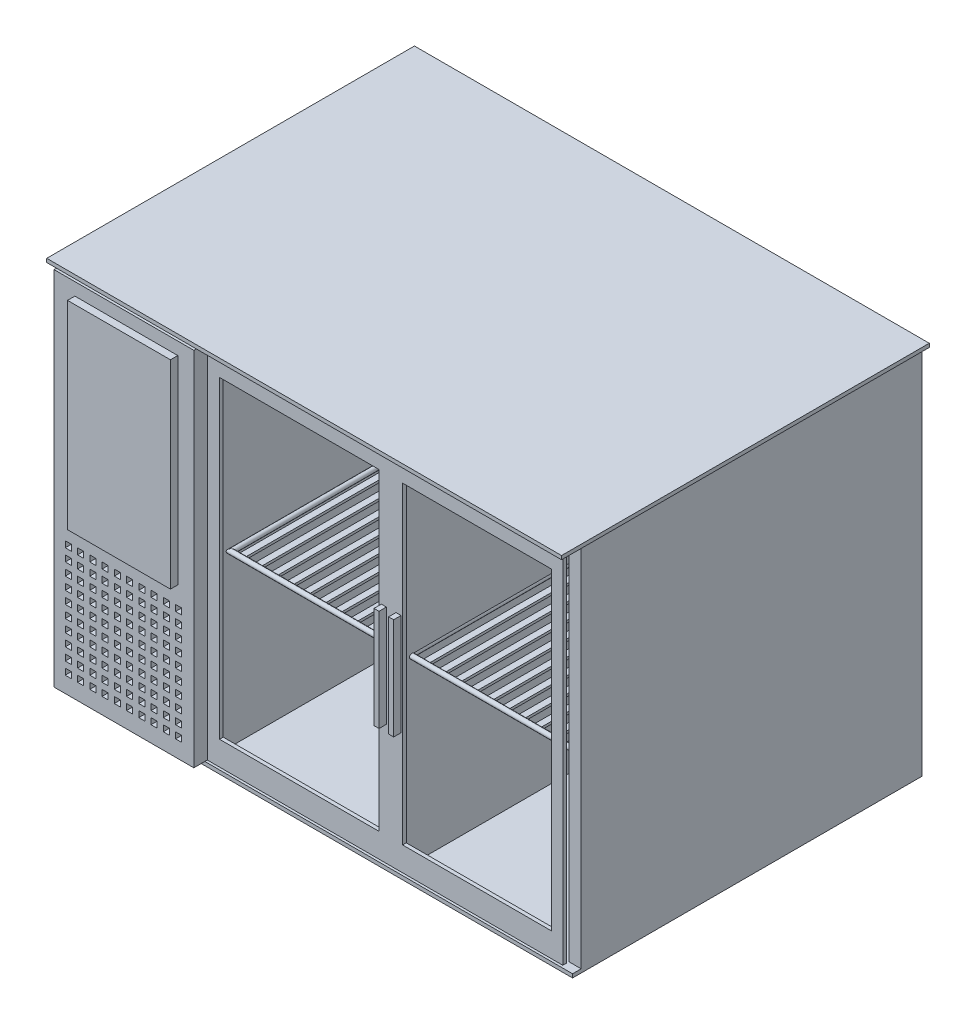
from build123d import *

# Parameters (mm, degrees)
SKETCH_1_W               = 420
SKETCH_1_H               = 300
EXTRUDE_1_DEPTH          = 3
SKETCH_2_W               = 414
SKETCH_2_H               = 294
EXTRUDE_2_DEPTH          = 300
SKETCH_4_W               = 414
SKETCH_4_H               = 285
EXTRUDE_3_DEPTH          = 3
SKETCH_5_W               = 414
SKETCH_5_H               = 5
CUT_EXTRUDE_2_DEPTH      = 16
SKETCH_7_W               = 290
SKETCH_7_H               = 295
CUT_EXTRUDE_4_DEPTH      = 292.885340732
SKETCH_8_W               = 300
SKETCH_8_H               = 295
CUT_EXTRUDE_8_DEPTH      = 16
EXTRUDE_START            = -14
EXTRUDE_6_DEPTH          = 3
EXTRUDE_START_2          = -155
SKETCH_10_W              = 278
SKETCH_10_H              = 303
EXTRUDE_7_DEPTH          = 12
SWEEP_1_PROFILE_R        = 2
SWEEP_1_PROFILE_R_2      = 1
SKETCH_92_W              = 5.167733577
SKETCH_92_H              = 269.760075432
EXTRUDE_17_DEPTH         = 2
PATTERN_LINEAR_1_COUNT   = 10
PATTERN_LINEAR_1_PITCH   = 13
MIRROR_1_COPY_1_SKETCH_W = 5.167733577
MIRROR_1_COPY_1_SKETCH_H = 269.760075432
MIRROR_1_COPY_1_DEPTH    = 2
MIRROR_1_COPY_2_SKETCH_W = 5.167733577
MIRROR_1_COPY_2_SKETCH_H = 269.760075432
MIRROR_1_COPY_2_DEPTH    = 2
MIRROR_1_COPY_3_SKETCH_W = 5.167733577
MIRROR_1_COPY_3_SKETCH_H = 269.760075432
MIRROR_1_COPY_3_DEPTH    = 2
MIRROR_1_COPY_4_SKETCH_W = 5.167733577
MIRROR_1_COPY_4_SKETCH_H = 269.760075432
MIRROR_1_COPY_4_DEPTH    = 2
MIRROR_1_COPY_5_SKETCH_W = 5.167733577
MIRROR_1_COPY_5_SKETCH_H = 269.760075432
MIRROR_1_COPY_5_DEPTH    = 2
MIRROR_1_COPY_6_SKETCH_W = 5.167733577
MIRROR_1_COPY_6_SKETCH_H = 269.760075432
MIRROR_1_COPY_6_DEPTH    = 2
MIRROR_1_COPY_7_SKETCH_W = 5.167733577
MIRROR_1_COPY_7_SKETCH_H = 269.760075432
MIRROR_1_COPY_7_DEPTH    = 2
MIRROR_1_COPY_8_SKETCH_W = 5.167733577
MIRROR_1_COPY_8_SKETCH_H = 269.760075432
MIRROR_1_COPY_8_DEPTH    = 2
MIRROR_1_COPY_9_SKETCH_W = 5.167733577
MIRROR_1_COPY_9_SKETCH_H = 269.760075432
MIRROR_1_COPY_9_DEPTH    = 2
SKETCH_97_W              = 4.098699483
SKETCH_97_H              = 82.865011284
EXTRUDE_18_DEPTH         = 6
SKETCH_98_W              = 5
SKETCH_98_H              = 5
CUT_EXTRUDE_11_DEPTH     = 6
SKETCH_99_W              = 5
SKETCH_99_H              = 5
CUT_EXTRUDE_12_DEPTH     = 6
SKETCH_100_W             = 83.959202725
SKETCH_100_H             = 162.034176658
EXTRUDE_19_DEPTH         = 6


with BuildPart() as part:
    # 草图1 → 凸台-拉伸1 (new body)
    with BuildSketch(Plane(origin=(0, 0, 0), x_dir=(1, 0, 0), z_dir=(0, 1, 0))):
        Rectangle(SKETCH_1_W, SKETCH_1_H)
    extrude(amount=EXTRUDE_1_DEPTH)

    # 草图2 → 凸台-拉伸2 (add)
    with BuildSketch(Plane.XZ):
        Rectangle(SKETCH_2_W, SKETCH_2_H)
    extrude(amount=EXTRUDE_2_DEPTH)

    # 草图4 → 凸台-拉伸3 (add)
    with BuildSketch(Plane.XZ.offset(300)):
        with Locations((0, -4.5)):
            Rectangle(SKETCH_4_W, SKETCH_4_H)
    extrude(amount=EXTRUDE_3_DEPTH)

    # 草图5 → 切除-拉伸2 (cut)
    with BuildSketch(Plane.XY.offset(147)):
        with Locations((0, -2.5)):
            Rectangle(SKETCH_5_W, SKETCH_5_H)
    extrude(amount=-CUT_EXTRUDE_2_DEPTH, mode=Mode.SUBTRACT)

    # 草图7 → 切除-拉伸4 (cut)
    with BuildSketch(Plane.XY.offset(147)):
        with Locations((52, -152.5)):
            Rectangle(SKETCH_7_W, SKETCH_7_H)
    extrude(amount=-CUT_EXTRUDE_4_DEPTH, mode=Mode.SUBTRACT)

    # 草图8 → 切除-拉伸8 (cut)
    with BuildSketch(Plane.XY.offset(147)):
        with Locations((57, -152.5)):
            Rectangle(SKETCH_8_W, SKETCH_8_H)
    extrude(amount=-CUT_EXTRUDE_8_DEPTH, mode=Mode.SUBTRACT)

    # 草图10 → 凸台-拉伸7 (add)
    with BuildSketch(Plane(origin=(207, 0, 0), x_dir=(0, 0, -1), z_dir=(1, 0, 0)).offset(EXTRUDE_START_2)):
        with Locations((8, -151.5)):
            Rectangle(SKETCH_10_W, SKETCH_10_H)
    extrude(amount=EXTRUDE_7_DEPTH)

    # 扫描-薄件1: sweep along a path in 草图14
    with BuildLine(Plane(origin=(0, -153, 0), x_dir=(-1, 0, 0), z_dir=(0, -1, 0))) as sweep_1_path:
        Line((-197.665809305, 141.895476789), (-62.598824861, 141.895476789))
        Line((-62.598824861, 141.895476789), (-62.598824861, -126))
        Line((-62.598824861, -126), (-197.665809305, -126))
        Line((-197.665809305, -126), (-197.665809305, 141.895476789))
    # 扫描-薄件1 profile (on start of the path) → 扫描-薄件1 (sweep)
    with BuildSketch(Plane(origin=(197.665809305, -153, -141.895476789), x_dir=(0, 0, -1), z_dir=(-1, 0, 0))):
        Circle(SWEEP_1_PROFILE_R)
        Circle(SWEEP_1_PROFILE_R_2, mode=Mode.SUBTRACT)
    sweep_1 = sweep(path=sweep_1_path.line, transition=Transition.RIGHT)

    # 草图92 → 凸台-拉伸17 (add)
    with BuildSketch(Plane(origin=(0, -153, 0), x_dir=(-1, 0, 0), z_dir=(0, -1, 0))):
        with Locations((-190.430982298, 8.3771237)):
            Rectangle(SKETCH_92_W, SKETCH_92_H)
    extrude_17 = extrude(amount=EXTRUDE_17_DEPTH)

    # 阵列(线性)1: 凸台-拉伸17 ×10
    with Locations(*[(-i * PATTERN_LINEAR_1_PITCH, 0, 0) for i in range(1, PATTERN_LINEAR_1_COUNT)]):
        add(extrude_17)

    # 镜向1: 扫描-薄件1, 凸台-拉伸17 across plane
    add(sweep_1.mirror(Plane(origin=(57, 0, 0), x_dir=(0, 0, 1), z_dir=(1, 0, 0))))
    add(extrude_17.mirror(Plane(origin=(57, 0, 0), x_dir=(0, 0, 1), z_dir=(1, 0, 0))))

    # 镜向1 copy 1 sketch → 镜向1 copy 1 (add)
    with BuildSketch(Plane(origin=(127, -153, 0), x_dir=(1, 0, 0), z_dir=(0, -1, 0))):
        with Locations((-190.430982298, -8.3771237)):
            Rectangle(MIRROR_1_COPY_1_SKETCH_W, MIRROR_1_COPY_1_SKETCH_H)
    extrude(amount=MIRROR_1_COPY_1_DEPTH)

    # 镜向1 copy 2 sketch → 镜向1 copy 2 (add)
    with BuildSketch(Plane(origin=(140, -153, 0), x_dir=(1, 0, 0), z_dir=(0, -1, 0))):
        with Locations((-190.430982298, -8.3771237)):
            Rectangle(MIRROR_1_COPY_2_SKETCH_W, MIRROR_1_COPY_2_SKETCH_H)
    extrude(amount=MIRROR_1_COPY_2_DEPTH)

    # 镜向1 copy 3 sketch → 镜向1 copy 3 (add)
    with BuildSketch(Plane(origin=(153, -153, 0), x_dir=(1, 0, 0), z_dir=(0, -1, 0))):
        with Locations((-190.430982298, -8.3771237)):
            Rectangle(MIRROR_1_COPY_3_SKETCH_W, MIRROR_1_COPY_3_SKETCH_H)
    extrude(amount=MIRROR_1_COPY_3_DEPTH)

    # 镜向1 copy 4 sketch → 镜向1 copy 4 (add)
    with BuildSketch(Plane(origin=(166, -153, 0), x_dir=(1, 0, 0), z_dir=(0, -1, 0))):
        with Locations((-190.430982298, -8.3771237)):
            Rectangle(MIRROR_1_COPY_4_SKETCH_W, MIRROR_1_COPY_4_SKETCH_H)
    extrude(amount=MIRROR_1_COPY_4_DEPTH)

    # 镜向1 copy 5 sketch → 镜向1 copy 5 (add)
    with BuildSketch(Plane(origin=(179, -153, 0), x_dir=(1, 0, 0), z_dir=(0, -1, 0))):
        with Locations((-190.430982298, -8.3771237)):
            Rectangle(MIRROR_1_COPY_5_SKETCH_W, MIRROR_1_COPY_5_SKETCH_H)
    extrude(amount=MIRROR_1_COPY_5_DEPTH)

    # 镜向1 copy 6 sketch → 镜向1 copy 6 (add)
    with BuildSketch(Plane(origin=(192, -153, 0), x_dir=(1, 0, 0), z_dir=(0, -1, 0))):
        with Locations((-190.430982298, -8.3771237)):
            Rectangle(MIRROR_1_COPY_6_SKETCH_W, MIRROR_1_COPY_6_SKETCH_H)
    extrude(amount=MIRROR_1_COPY_6_DEPTH)

    # 镜向1 copy 7 sketch → 镜向1 copy 7 (add)
    with BuildSketch(Plane(origin=(205, -153, 0), x_dir=(1, 0, 0), z_dir=(0, -1, 0))):
        with Locations((-190.430982298, -8.3771237)):
            Rectangle(MIRROR_1_COPY_7_SKETCH_W, MIRROR_1_COPY_7_SKETCH_H)
    extrude(amount=MIRROR_1_COPY_7_DEPTH)

    # 镜向1 copy 8 sketch → 镜向1 copy 8 (add)
    with BuildSketch(Plane(origin=(218, -153, 0), x_dir=(1, 0, 0), z_dir=(0, -1, 0))):
        with Locations((-190.430982298, -8.3771237)):
            Rectangle(MIRROR_1_COPY_8_SKETCH_W, MIRROR_1_COPY_8_SKETCH_H)
    extrude(amount=MIRROR_1_COPY_8_DEPTH)

    # 镜向1 copy 9 sketch → 镜向1 copy 9 (add)
    with BuildSketch(Plane(origin=(231, -153, 0), x_dir=(1, 0, 0), z_dir=(0, -1, 0))):
        with Locations((-190.430982298, -8.3771237)):
            Rectangle(MIRROR_1_COPY_9_SKETCH_W, MIRROR_1_COPY_9_SKETCH_H)
    extrude(amount=MIRROR_1_COPY_9_DEPTH)


with BuildPart() as body_2:
    # 草图9 → 凸台-拉伸6 (new body)
    with BuildSketch(Plane.XY.offset(147).offset(EXTRUDE_START)):
        Polygon((-93, -5), (-83, -24.666666667), (47, -24.666666667), (57, -5), align=None)
        Polygon((-83, -280.333333333), (-93, -300), (-93, -5), (-83, -24.666666667), align=None)
        Polygon((57, -5), (47, -24.666666667), (47, -280.333333333), (57, -300), align=None)
        Polygon((66.333333333, -280.333333333), (57, -300), (57, -5), (66.333333333, -24.666666667), align=None)
        Polygon((57, -5), (66.333333333, -24.666666667), (187.666666667, -24.666666667), (197, -5), align=None)
        Polygon((187.666666667, -280.333333333), (187.666666667, -24.666666667), (197, -5), (197, -300), align=None)
        Polygon((66.333333333, -280.333333333), (187.666666667, -280.333333333), (197, -300), (57, -300), align=None)
        Polygon((-83, -280.333333333), (47, -280.333333333), (57, -300), (-93, -300), align=None)
    extrude(amount=EXTRUDE_6_DEPTH)


    add(part.part)  # 凸台-拉伸18 merges part
    # 草图97 → 凸台-拉伸18 (add)
    with BuildSketch(Plane.XY.offset(136)):
        with Locations((51.033719779, -160.278584722)):
            Rectangle(SKETCH_97_W, SKETCH_97_H)
    extrude_18 = extrude(amount=EXTRUDE_18_DEPTH)

    # 镜向2: 凸台-拉伸18 across plane
    add(extrude_18.mirror(Plane(origin=(57, 0, 0), x_dir=(0, 0, 1), z_dir=(1, 0, 0))))

    # 草图98 → 切除-拉伸11 (cut)
    with BuildSketch(Plane.XY.offset(147)):
        with Locations((-185.391714271, -284.494021631)):
            Rectangle(SKETCH_98_W, SKETCH_98_H)
        with Locations((-195.391714271, -284.494021631)):
            Rectangle(SKETCH_98_W, SKETCH_98_H)
        with Locations((-175.391714271, -284.494021631)):
            Rectangle(SKETCH_98_W, SKETCH_98_H)
        with Locations((-165.391714271, -284.494021631)):
            Rectangle(SKETCH_98_W, SKETCH_98_H)
        with Locations((-155.391714271, -284.494021631)):
            Rectangle(SKETCH_98_W, SKETCH_98_H)
        with Locations((-145.391714271, -284.494021631)):
            Rectangle(SKETCH_98_W, SKETCH_98_H)
        with Locations((-135.391714271, -284.494021631)):
            Rectangle(SKETCH_98_W, SKETCH_98_H)
        with Locations((-125.391714271, -284.494021631)):
            Rectangle(SKETCH_98_W, SKETCH_98_H)
        with Locations((-115.391714271, -284.494021631)):
            Rectangle(SKETCH_98_W, SKETCH_98_H)
        with Locations((-105.391714271, -284.494021631)):
            Rectangle(SKETCH_98_W, SKETCH_98_H)
        with Locations((-185.391714271, -274.494021631)):
            Rectangle(SKETCH_98_W, SKETCH_98_H)
        with Locations((-175.391714271, -274.494021631)):
            Rectangle(SKETCH_98_W, SKETCH_98_H)
        with Locations((-165.391714271, -274.494021631)):
            Rectangle(SKETCH_98_W, SKETCH_98_H)
        with Locations((-155.391714271, -274.494021631)):
            Rectangle(SKETCH_98_W, SKETCH_98_H)
        with Locations((-145.391714271, -274.494021631)):
            Rectangle(SKETCH_98_W, SKETCH_98_H)
        with Locations((-135.391714271, -274.494021631)):
            Rectangle(SKETCH_98_W, SKETCH_98_H)
        with Locations((-125.391714271, -274.494021631)):
            Rectangle(SKETCH_98_W, SKETCH_98_H)
        with Locations((-115.391714271, -274.494021631)):
            Rectangle(SKETCH_98_W, SKETCH_98_H)
        with Locations((-105.391714271, -274.494021631)):
            Rectangle(SKETCH_98_W, SKETCH_98_H)
        with Locations((-185.391714271, -264.494021631)):
            Rectangle(SKETCH_98_W, SKETCH_98_H)
        with Locations((-175.391714271, -264.494021631)):
            Rectangle(SKETCH_98_W, SKETCH_98_H)
        with Locations((-165.391714271, -264.494021631)):
            Rectangle(SKETCH_98_W, SKETCH_98_H)
        with Locations((-155.391714271, -264.494021631)):
            Rectangle(SKETCH_98_W, SKETCH_98_H)
        with Locations((-145.391714271, -264.494021631)):
            Rectangle(SKETCH_98_W, SKETCH_98_H)
        with Locations((-135.391714271, -264.494021631)):
            Rectangle(SKETCH_98_W, SKETCH_98_H)
        with Locations((-125.391714271, -264.494021631)):
            Rectangle(SKETCH_98_W, SKETCH_98_H)
        with Locations((-115.391714271, -264.494021631)):
            Rectangle(SKETCH_98_W, SKETCH_98_H)
        with Locations((-105.391714271, -264.494021631)):
            Rectangle(SKETCH_98_W, SKETCH_98_H)
        with Locations((-185.391714271, -254.494021631)):
            Rectangle(SKETCH_98_W, SKETCH_98_H)
        with Locations((-175.391714271, -254.494021631)):
            Rectangle(SKETCH_98_W, SKETCH_98_H)
        with Locations((-165.391714271, -254.494021631)):
            Rectangle(SKETCH_98_W, SKETCH_98_H)
        with Locations((-155.391714271, -254.494021631)):
            Rectangle(SKETCH_98_W, SKETCH_98_H)
        with Locations((-145.391714271, -254.494021631)):
            Rectangle(SKETCH_98_W, SKETCH_98_H)
        with Locations((-135.391714271, -254.494021631)):
            Rectangle(SKETCH_98_W, SKETCH_98_H)
        with Locations((-125.391714271, -254.494021631)):
            Rectangle(SKETCH_98_W, SKETCH_98_H)
        with Locations((-115.391714271, -254.494021631)):
            Rectangle(SKETCH_98_W, SKETCH_98_H)
        with Locations((-105.391714271, -254.494021631)):
            Rectangle(SKETCH_98_W, SKETCH_98_H)
        with Locations((-185.391714271, -244.494021631)):
            Rectangle(SKETCH_98_W, SKETCH_98_H)
        with Locations((-175.391714271, -244.494021631)):
            Rectangle(SKETCH_98_W, SKETCH_98_H)
        with Locations((-165.391714271, -244.494021631)):
            Rectangle(SKETCH_98_W, SKETCH_98_H)
        with Locations((-155.391714271, -244.494021631)):
            Rectangle(SKETCH_98_W, SKETCH_98_H)
        with Locations((-145.391714271, -244.494021631)):
            Rectangle(SKETCH_98_W, SKETCH_98_H)
        with Locations((-135.391714271, -244.494021631)):
            Rectangle(SKETCH_98_W, SKETCH_98_H)
        with Locations((-125.391714271, -244.494021631)):
            Rectangle(SKETCH_98_W, SKETCH_98_H)
        with Locations((-115.391714271, -244.494021631)):
            Rectangle(SKETCH_98_W, SKETCH_98_H)
        with Locations((-105.391714271, -244.494021631)):
            Rectangle(SKETCH_98_W, SKETCH_98_H)
        with Locations((-185.391714271, -234.494021631)):
            Rectangle(SKETCH_98_W, SKETCH_98_H)
        with Locations((-175.391714271, -234.494021631)):
            Rectangle(SKETCH_98_W, SKETCH_98_H)
        with Locations((-165.391714271, -234.494021631)):
            Rectangle(SKETCH_98_W, SKETCH_98_H)
        with Locations((-155.391714271, -234.494021631)):
            Rectangle(SKETCH_98_W, SKETCH_98_H)
        with Locations((-145.391714271, -234.494021631)):
            Rectangle(SKETCH_98_W, SKETCH_98_H)
        with Locations((-135.391714271, -234.494021631)):
            Rectangle(SKETCH_98_W, SKETCH_98_H)
        with Locations((-125.391714271, -234.494021631)):
            Rectangle(SKETCH_98_W, SKETCH_98_H)
        with Locations((-115.391714271, -234.494021631)):
            Rectangle(SKETCH_98_W, SKETCH_98_H)
        with Locations((-105.391714271, -234.494021631)):
            Rectangle(SKETCH_98_W, SKETCH_98_H)
        with Locations((-185.391714271, -224.494021631)):
            Rectangle(SKETCH_98_W, SKETCH_98_H)
        with Locations((-175.391714271, -224.494021631)):
            Rectangle(SKETCH_98_W, SKETCH_98_H)
        with Locations((-165.391714271, -224.494021631)):
            Rectangle(SKETCH_98_W, SKETCH_98_H)
        with Locations((-155.391714271, -224.494021631)):
            Rectangle(SKETCH_98_W, SKETCH_98_H)
        with Locations((-145.391714271, -224.494021631)):
            Rectangle(SKETCH_98_W, SKETCH_98_H)
        with Locations((-135.391714271, -224.494021631)):
            Rectangle(SKETCH_98_W, SKETCH_98_H)
        with Locations((-125.391714271, -224.494021631)):
            Rectangle(SKETCH_98_W, SKETCH_98_H)
        with Locations((-115.391714271, -224.494021631)):
            Rectangle(SKETCH_98_W, SKETCH_98_H)
        with Locations((-105.391714271, -224.494021631)):
            Rectangle(SKETCH_98_W, SKETCH_98_H)
        with Locations((-185.391714271, -214.494021631)):
            Rectangle(SKETCH_98_W, SKETCH_98_H)
        with Locations((-175.391714271, -214.494021631)):
            Rectangle(SKETCH_98_W, SKETCH_98_H)
        with Locations((-165.391714271, -214.494021631)):
            Rectangle(SKETCH_98_W, SKETCH_98_H)
        with Locations((-155.391714271, -214.494021631)):
            Rectangle(SKETCH_98_W, SKETCH_98_H)
        with Locations((-145.391714271, -214.494021631)):
            Rectangle(SKETCH_98_W, SKETCH_98_H)
        with Locations((-135.391714271, -214.494021631)):
            Rectangle(SKETCH_98_W, SKETCH_98_H)
        with Locations((-125.391714271, -214.494021631)):
            Rectangle(SKETCH_98_W, SKETCH_98_H)
        with Locations((-115.391714271, -214.494021631)):
            Rectangle(SKETCH_98_W, SKETCH_98_H)
        with Locations((-105.391714271, -214.494021631)):
            Rectangle(SKETCH_98_W, SKETCH_98_H)
        with Locations((-185.391714271, -204.494021631)):
            Rectangle(SKETCH_98_W, SKETCH_98_H)
        with Locations((-175.391714271, -204.494021631)):
            Rectangle(SKETCH_98_W, SKETCH_98_H)
        with Locations((-165.391714271, -204.494021631)):
            Rectangle(SKETCH_98_W, SKETCH_98_H)
        with Locations((-155.391714271, -204.494021631)):
            Rectangle(SKETCH_98_W, SKETCH_98_H)
        with Locations((-145.391714271, -204.494021631)):
            Rectangle(SKETCH_98_W, SKETCH_98_H)
        with Locations((-135.391714271, -204.494021631)):
            Rectangle(SKETCH_98_W, SKETCH_98_H)
        with Locations((-125.391714271, -204.494021631)):
            Rectangle(SKETCH_98_W, SKETCH_98_H)
        with Locations((-115.391714271, -204.494021631)):
            Rectangle(SKETCH_98_W, SKETCH_98_H)
        with Locations((-105.391714271, -204.494021631)):
            Rectangle(SKETCH_98_W, SKETCH_98_H)
        with Locations((-185.391714271, -194.494021631)):
            Rectangle(SKETCH_98_W, SKETCH_98_H)
        with Locations((-175.391714271, -194.494021631)):
            Rectangle(SKETCH_98_W, SKETCH_98_H)
        with Locations((-165.391714271, -194.494021631)):
            Rectangle(SKETCH_98_W, SKETCH_98_H)
        with Locations((-155.391714271, -194.494021631)):
            Rectangle(SKETCH_98_W, SKETCH_98_H)
        with Locations((-145.391714271, -194.494021631)):
            Rectangle(SKETCH_98_W, SKETCH_98_H)
        with Locations((-135.391714271, -194.494021631)):
            Rectangle(SKETCH_98_W, SKETCH_98_H)
        with Locations((-125.391714271, -194.494021631)):
            Rectangle(SKETCH_98_W, SKETCH_98_H)
        with Locations((-115.391714271, -194.494021631)):
            Rectangle(SKETCH_98_W, SKETCH_98_H)
        with Locations((-105.391714271, -194.494021631)):
            Rectangle(SKETCH_98_W, SKETCH_98_H)
        with Locations((-195.391714271, -274.494021631)):
            Rectangle(SKETCH_98_W, SKETCH_98_H)
        with Locations((-195.391714271, -264.494021631)):
            Rectangle(SKETCH_98_W, SKETCH_98_H)
        with Locations((-195.391714271, -254.494021631)):
            Rectangle(SKETCH_98_W, SKETCH_98_H)
        with Locations((-195.391714271, -244.494021631)):
            Rectangle(SKETCH_98_W, SKETCH_98_H)
        with Locations((-195.391714271, -234.494021631)):
            Rectangle(SKETCH_98_W, SKETCH_98_H)
        with Locations((-195.391714271, -224.494021631)):
            Rectangle(SKETCH_98_W, SKETCH_98_H)
        with Locations((-195.391714271, -214.494021631)):
            Rectangle(SKETCH_98_W, SKETCH_98_H)
        with Locations((-195.391714271, -204.494021631)):
            Rectangle(SKETCH_98_W, SKETCH_98_H)
        with Locations((-195.391714271, -194.494021631)):
            Rectangle(SKETCH_98_W, SKETCH_98_H)
    extrude(amount=-CUT_EXTRUDE_11_DEPTH, mode=Mode.SUBTRACT)

    # 草图99 → 切除-拉伸12 (cut)
    with BuildSketch(Plane.ZY.offset(207)):
        with Locations((124.299611321, -291.625798673)):
            Rectangle(SKETCH_99_W, SKETCH_99_H)
        with Locations((134.299611321, -291.625798673)):
            Rectangle(SKETCH_99_W, SKETCH_99_H)
        with Locations((114.299611321, -291.625798673)):
            Rectangle(SKETCH_99_W, SKETCH_99_H)
        with Locations((104.299611321, -291.625798673)):
            Rectangle(SKETCH_99_W, SKETCH_99_H)
        with Locations((94.299611321, -291.625798673)):
            Rectangle(SKETCH_99_W, SKETCH_99_H)
        with Locations((84.299611321, -291.625798673)):
            Rectangle(SKETCH_99_W, SKETCH_99_H)
        with Locations((74.299611321, -291.625798673)):
            Rectangle(SKETCH_99_W, SKETCH_99_H)
        with Locations((64.299611321, -291.625798673)):
            Rectangle(SKETCH_99_W, SKETCH_99_H)
        with Locations((54.299611321, -291.625798673)):
            Rectangle(SKETCH_99_W, SKETCH_99_H)
        with Locations((44.299611321, -291.625798673)):
            Rectangle(SKETCH_99_W, SKETCH_99_H)
        with Locations((34.299611321, -291.625798673)):
            Rectangle(SKETCH_99_W, SKETCH_99_H)
        with Locations((24.299611321, -291.625798673)):
            Rectangle(SKETCH_99_W, SKETCH_99_H)
        with Locations((14.299611321, -291.625798673)):
            Rectangle(SKETCH_99_W, SKETCH_99_H)
        with Locations((4.299611321, -291.625798673)):
            Rectangle(SKETCH_99_W, SKETCH_99_H)
        with Locations((-5.700388679, -291.625798673)):
            Rectangle(SKETCH_99_W, SKETCH_99_H)
        with Locations((-15.700388679, -291.625798673)):
            Rectangle(SKETCH_99_W, SKETCH_99_H)
        with Locations((-25.700388679, -291.625798673)):
            Rectangle(SKETCH_99_W, SKETCH_99_H)
        with Locations((-35.700388679, -291.625798673)):
            Rectangle(SKETCH_99_W, SKETCH_99_H)
        with Locations((-45.700388679, -291.625798673)):
            Rectangle(SKETCH_99_W, SKETCH_99_H)
        with Locations((-55.700388679, -291.625798673)):
            Rectangle(SKETCH_99_W, SKETCH_99_H)
        with Locations((124.299611321, -281.625798673)):
            Rectangle(SKETCH_99_W, SKETCH_99_H)
        with Locations((114.299611321, -281.625798673)):
            Rectangle(SKETCH_99_W, SKETCH_99_H)
        with Locations((104.299611321, -281.625798673)):
            Rectangle(SKETCH_99_W, SKETCH_99_H)
        with Locations((94.299611321, -281.625798673)):
            Rectangle(SKETCH_99_W, SKETCH_99_H)
        with Locations((84.299611321, -281.625798673)):
            Rectangle(SKETCH_99_W, SKETCH_99_H)
        with Locations((74.299611321, -281.625798673)):
            Rectangle(SKETCH_99_W, SKETCH_99_H)
        with Locations((64.299611321, -281.625798673)):
            Rectangle(SKETCH_99_W, SKETCH_99_H)
        with Locations((54.299611321, -281.625798673)):
            Rectangle(SKETCH_99_W, SKETCH_99_H)
        with Locations((44.299611321, -281.625798673)):
            Rectangle(SKETCH_99_W, SKETCH_99_H)
        with Locations((34.299611321, -281.625798673)):
            Rectangle(SKETCH_99_W, SKETCH_99_H)
        with Locations((24.299611321, -281.625798673)):
            Rectangle(SKETCH_99_W, SKETCH_99_H)
        with Locations((14.299611321, -281.625798673)):
            Rectangle(SKETCH_99_W, SKETCH_99_H)
        with Locations((4.299611321, -281.625798673)):
            Rectangle(SKETCH_99_W, SKETCH_99_H)
        with Locations((-5.700388679, -281.625798673)):
            Rectangle(SKETCH_99_W, SKETCH_99_H)
        with Locations((-15.700388679, -281.625798673)):
            Rectangle(SKETCH_99_W, SKETCH_99_H)
        with Locations((-25.700388679, -281.625798673)):
            Rectangle(SKETCH_99_W, SKETCH_99_H)
        with Locations((-35.700388679, -281.625798673)):
            Rectangle(SKETCH_99_W, SKETCH_99_H)
        with Locations((-45.700388679, -281.625798673)):
            Rectangle(SKETCH_99_W, SKETCH_99_H)
        with Locations((-55.700388679, -281.625798673)):
            Rectangle(SKETCH_99_W, SKETCH_99_H)
        with Locations((124.299611321, -271.625798673)):
            Rectangle(SKETCH_99_W, SKETCH_99_H)
        with Locations((114.299611321, -271.625798673)):
            Rectangle(SKETCH_99_W, SKETCH_99_H)
        with Locations((104.299611321, -271.625798673)):
            Rectangle(SKETCH_99_W, SKETCH_99_H)
        with Locations((94.299611321, -271.625798673)):
            Rectangle(SKETCH_99_W, SKETCH_99_H)
        with Locations((84.299611321, -271.625798673)):
            Rectangle(SKETCH_99_W, SKETCH_99_H)
        with Locations((74.299611321, -271.625798673)):
            Rectangle(SKETCH_99_W, SKETCH_99_H)
        with Locations((64.299611321, -271.625798673)):
            Rectangle(SKETCH_99_W, SKETCH_99_H)
        with Locations((54.299611321, -271.625798673)):
            Rectangle(SKETCH_99_W, SKETCH_99_H)
        with Locations((44.299611321, -271.625798673)):
            Rectangle(SKETCH_99_W, SKETCH_99_H)
        with Locations((34.299611321, -271.625798673)):
            Rectangle(SKETCH_99_W, SKETCH_99_H)
        with Locations((24.299611321, -271.625798673)):
            Rectangle(SKETCH_99_W, SKETCH_99_H)
        with Locations((14.299611321, -271.625798673)):
            Rectangle(SKETCH_99_W, SKETCH_99_H)
        with Locations((4.299611321, -271.625798673)):
            Rectangle(SKETCH_99_W, SKETCH_99_H)
        with Locations((-5.700388679, -271.625798673)):
            Rectangle(SKETCH_99_W, SKETCH_99_H)
        with Locations((-15.700388679, -271.625798673)):
            Rectangle(SKETCH_99_W, SKETCH_99_H)
        with Locations((-25.700388679, -271.625798673)):
            Rectangle(SKETCH_99_W, SKETCH_99_H)
        with Locations((-35.700388679, -271.625798673)):
            Rectangle(SKETCH_99_W, SKETCH_99_H)
        with Locations((-45.700388679, -271.625798673)):
            Rectangle(SKETCH_99_W, SKETCH_99_H)
        with Locations((-55.700388679, -271.625798673)):
            Rectangle(SKETCH_99_W, SKETCH_99_H)
        with Locations((124.299611321, -261.625798673)):
            Rectangle(SKETCH_99_W, SKETCH_99_H)
        with Locations((114.299611321, -261.625798673)):
            Rectangle(SKETCH_99_W, SKETCH_99_H)
        with Locations((104.299611321, -261.625798673)):
            Rectangle(SKETCH_99_W, SKETCH_99_H)
        with Locations((94.299611321, -261.625798673)):
            Rectangle(SKETCH_99_W, SKETCH_99_H)
        with Locations((84.299611321, -261.625798673)):
            Rectangle(SKETCH_99_W, SKETCH_99_H)
        with Locations((74.299611321, -261.625798673)):
            Rectangle(SKETCH_99_W, SKETCH_99_H)
        with Locations((64.299611321, -261.625798673)):
            Rectangle(SKETCH_99_W, SKETCH_99_H)
        with Locations((54.299611321, -261.625798673)):
            Rectangle(SKETCH_99_W, SKETCH_99_H)
        with Locations((44.299611321, -261.625798673)):
            Rectangle(SKETCH_99_W, SKETCH_99_H)
        with Locations((34.299611321, -261.625798673)):
            Rectangle(SKETCH_99_W, SKETCH_99_H)
        with Locations((24.299611321, -261.625798673)):
            Rectangle(SKETCH_99_W, SKETCH_99_H)
        with Locations((14.299611321, -261.625798673)):
            Rectangle(SKETCH_99_W, SKETCH_99_H)
        with Locations((4.299611321, -261.625798673)):
            Rectangle(SKETCH_99_W, SKETCH_99_H)
        with Locations((-5.700388679, -261.625798673)):
            Rectangle(SKETCH_99_W, SKETCH_99_H)
        with Locations((-15.700388679, -261.625798673)):
            Rectangle(SKETCH_99_W, SKETCH_99_H)
        with Locations((-25.700388679, -261.625798673)):
            Rectangle(SKETCH_99_W, SKETCH_99_H)
        with Locations((-35.700388679, -261.625798673)):
            Rectangle(SKETCH_99_W, SKETCH_99_H)
        with Locations((-45.700388679, -261.625798673)):
            Rectangle(SKETCH_99_W, SKETCH_99_H)
        with Locations((-55.700388679, -261.625798673)):
            Rectangle(SKETCH_99_W, SKETCH_99_H)
        with Locations((124.299611321, -251.625798673)):
            Rectangle(SKETCH_99_W, SKETCH_99_H)
        with Locations((114.299611321, -251.625798673)):
            Rectangle(SKETCH_99_W, SKETCH_99_H)
        with Locations((104.299611321, -251.625798673)):
            Rectangle(SKETCH_99_W, SKETCH_99_H)
        with Locations((94.299611321, -251.625798673)):
            Rectangle(SKETCH_99_W, SKETCH_99_H)
        with Locations((84.299611321, -251.625798673)):
            Rectangle(SKETCH_99_W, SKETCH_99_H)
        with Locations((74.299611321, -251.625798673)):
            Rectangle(SKETCH_99_W, SKETCH_99_H)
        with Locations((64.299611321, -251.625798673)):
            Rectangle(SKETCH_99_W, SKETCH_99_H)
        with Locations((54.299611321, -251.625798673)):
            Rectangle(SKETCH_99_W, SKETCH_99_H)
        with Locations((44.299611321, -251.625798673)):
            Rectangle(SKETCH_99_W, SKETCH_99_H)
        with Locations((34.299611321, -251.625798673)):
            Rectangle(SKETCH_99_W, SKETCH_99_H)
        with Locations((24.299611321, -251.625798673)):
            Rectangle(SKETCH_99_W, SKETCH_99_H)
        with Locations((14.299611321, -251.625798673)):
            Rectangle(SKETCH_99_W, SKETCH_99_H)
        with Locations((4.299611321, -251.625798673)):
            Rectangle(SKETCH_99_W, SKETCH_99_H)
        with Locations((-5.700388679, -251.625798673)):
            Rectangle(SKETCH_99_W, SKETCH_99_H)
        with Locations((-15.700388679, -251.625798673)):
            Rectangle(SKETCH_99_W, SKETCH_99_H)
        with Locations((-25.700388679, -251.625798673)):
            Rectangle(SKETCH_99_W, SKETCH_99_H)
        with Locations((-35.700388679, -251.625798673)):
            Rectangle(SKETCH_99_W, SKETCH_99_H)
        with Locations((-45.700388679, -251.625798673)):
            Rectangle(SKETCH_99_W, SKETCH_99_H)
        with Locations((-55.700388679, -251.625798673)):
            Rectangle(SKETCH_99_W, SKETCH_99_H)
        with Locations((124.299611321, -241.625798673)):
            Rectangle(SKETCH_99_W, SKETCH_99_H)
        with Locations((114.299611321, -241.625798673)):
            Rectangle(SKETCH_99_W, SKETCH_99_H)
        with Locations((104.299611321, -241.625798673)):
            Rectangle(SKETCH_99_W, SKETCH_99_H)
        with Locations((94.299611321, -241.625798673)):
            Rectangle(SKETCH_99_W, SKETCH_99_H)
        with Locations((84.299611321, -241.625798673)):
            Rectangle(SKETCH_99_W, SKETCH_99_H)
        with Locations((74.299611321, -241.625798673)):
            Rectangle(SKETCH_99_W, SKETCH_99_H)
        with Locations((64.299611321, -241.625798673)):
            Rectangle(SKETCH_99_W, SKETCH_99_H)
        with Locations((54.299611321, -241.625798673)):
            Rectangle(SKETCH_99_W, SKETCH_99_H)
        with Locations((44.299611321, -241.625798673)):
            Rectangle(SKETCH_99_W, SKETCH_99_H)
        with Locations((34.299611321, -241.625798673)):
            Rectangle(SKETCH_99_W, SKETCH_99_H)
        with Locations((24.299611321, -241.625798673)):
            Rectangle(SKETCH_99_W, SKETCH_99_H)
        with Locations((14.299611321, -241.625798673)):
            Rectangle(SKETCH_99_W, SKETCH_99_H)
        with Locations((4.299611321, -241.625798673)):
            Rectangle(SKETCH_99_W, SKETCH_99_H)
        with Locations((-5.700388679, -241.625798673)):
            Rectangle(SKETCH_99_W, SKETCH_99_H)
        with Locations((-15.700388679, -241.625798673)):
            Rectangle(SKETCH_99_W, SKETCH_99_H)
        with Locations((-25.700388679, -241.625798673)):
            Rectangle(SKETCH_99_W, SKETCH_99_H)
        with Locations((-35.700388679, -241.625798673)):
            Rectangle(SKETCH_99_W, SKETCH_99_H)
        with Locations((-45.700388679, -241.625798673)):
            Rectangle(SKETCH_99_W, SKETCH_99_H)
        with Locations((-55.700388679, -241.625798673)):
            Rectangle(SKETCH_99_W, SKETCH_99_H)
        with Locations((124.299611321, -231.625798673)):
            Rectangle(SKETCH_99_W, SKETCH_99_H)
        with Locations((114.299611321, -231.625798673)):
            Rectangle(SKETCH_99_W, SKETCH_99_H)
        with Locations((104.299611321, -231.625798673)):
            Rectangle(SKETCH_99_W, SKETCH_99_H)
        with Locations((94.299611321, -231.625798673)):
            Rectangle(SKETCH_99_W, SKETCH_99_H)
        with Locations((84.299611321, -231.625798673)):
            Rectangle(SKETCH_99_W, SKETCH_99_H)
        with Locations((74.299611321, -231.625798673)):
            Rectangle(SKETCH_99_W, SKETCH_99_H)
        with Locations((64.299611321, -231.625798673)):
            Rectangle(SKETCH_99_W, SKETCH_99_H)
        with Locations((54.299611321, -231.625798673)):
            Rectangle(SKETCH_99_W, SKETCH_99_H)
        with Locations((44.299611321, -231.625798673)):
            Rectangle(SKETCH_99_W, SKETCH_99_H)
        with Locations((34.299611321, -231.625798673)):
            Rectangle(SKETCH_99_W, SKETCH_99_H)
        with Locations((24.299611321, -231.625798673)):
            Rectangle(SKETCH_99_W, SKETCH_99_H)
        with Locations((14.299611321, -231.625798673)):
            Rectangle(SKETCH_99_W, SKETCH_99_H)
        with Locations((4.299611321, -231.625798673)):
            Rectangle(SKETCH_99_W, SKETCH_99_H)
        with Locations((-5.700388679, -231.625798673)):
            Rectangle(SKETCH_99_W, SKETCH_99_H)
        with Locations((-15.700388679, -231.625798673)):
            Rectangle(SKETCH_99_W, SKETCH_99_H)
        with Locations((-25.700388679, -231.625798673)):
            Rectangle(SKETCH_99_W, SKETCH_99_H)
        with Locations((-35.700388679, -231.625798673)):
            Rectangle(SKETCH_99_W, SKETCH_99_H)
        with Locations((-45.700388679, -231.625798673)):
            Rectangle(SKETCH_99_W, SKETCH_99_H)
        with Locations((-55.700388679, -231.625798673)):
            Rectangle(SKETCH_99_W, SKETCH_99_H)
        with Locations((124.299611321, -221.625798673)):
            Rectangle(SKETCH_99_W, SKETCH_99_H)
        with Locations((114.299611321, -221.625798673)):
            Rectangle(SKETCH_99_W, SKETCH_99_H)
        with Locations((104.299611321, -221.625798673)):
            Rectangle(SKETCH_99_W, SKETCH_99_H)
        with Locations((94.299611321, -221.625798673)):
            Rectangle(SKETCH_99_W, SKETCH_99_H)
        with Locations((84.299611321, -221.625798673)):
            Rectangle(SKETCH_99_W, SKETCH_99_H)
        with Locations((74.299611321, -221.625798673)):
            Rectangle(SKETCH_99_W, SKETCH_99_H)
        with Locations((64.299611321, -221.625798673)):
            Rectangle(SKETCH_99_W, SKETCH_99_H)
        with Locations((54.299611321, -221.625798673)):
            Rectangle(SKETCH_99_W, SKETCH_99_H)
        with Locations((44.299611321, -221.625798673)):
            Rectangle(SKETCH_99_W, SKETCH_99_H)
        with Locations((34.299611321, -221.625798673)):
            Rectangle(SKETCH_99_W, SKETCH_99_H)
        with Locations((24.299611321, -221.625798673)):
            Rectangle(SKETCH_99_W, SKETCH_99_H)
        with Locations((14.299611321, -221.625798673)):
            Rectangle(SKETCH_99_W, SKETCH_99_H)
        with Locations((4.299611321, -221.625798673)):
            Rectangle(SKETCH_99_W, SKETCH_99_H)
        with Locations((-5.700388679, -221.625798673)):
            Rectangle(SKETCH_99_W, SKETCH_99_H)
        with Locations((-15.700388679, -221.625798673)):
            Rectangle(SKETCH_99_W, SKETCH_99_H)
        with Locations((-25.700388679, -221.625798673)):
            Rectangle(SKETCH_99_W, SKETCH_99_H)
        with Locations((-35.700388679, -221.625798673)):
            Rectangle(SKETCH_99_W, SKETCH_99_H)
        with Locations((-45.700388679, -221.625798673)):
            Rectangle(SKETCH_99_W, SKETCH_99_H)
        with Locations((-55.700388679, -221.625798673)):
            Rectangle(SKETCH_99_W, SKETCH_99_H)
        with Locations((124.299611321, -211.625798673)):
            Rectangle(SKETCH_99_W, SKETCH_99_H)
        with Locations((114.299611321, -211.625798673)):
            Rectangle(SKETCH_99_W, SKETCH_99_H)
        with Locations((104.299611321, -211.625798673)):
            Rectangle(SKETCH_99_W, SKETCH_99_H)
        with Locations((94.299611321, -211.625798673)):
            Rectangle(SKETCH_99_W, SKETCH_99_H)
        with Locations((84.299611321, -211.625798673)):
            Rectangle(SKETCH_99_W, SKETCH_99_H)
        with Locations((74.299611321, -211.625798673)):
            Rectangle(SKETCH_99_W, SKETCH_99_H)
        with Locations((64.299611321, -211.625798673)):
            Rectangle(SKETCH_99_W, SKETCH_99_H)
        with Locations((54.299611321, -211.625798673)):
            Rectangle(SKETCH_99_W, SKETCH_99_H)
        with Locations((44.299611321, -211.625798673)):
            Rectangle(SKETCH_99_W, SKETCH_99_H)
        with Locations((34.299611321, -211.625798673)):
            Rectangle(SKETCH_99_W, SKETCH_99_H)
        with Locations((24.299611321, -211.625798673)):
            Rectangle(SKETCH_99_W, SKETCH_99_H)
        with Locations((14.299611321, -211.625798673)):
            Rectangle(SKETCH_99_W, SKETCH_99_H)
        with Locations((4.299611321, -211.625798673)):
            Rectangle(SKETCH_99_W, SKETCH_99_H)
        with Locations((-5.700388679, -211.625798673)):
            Rectangle(SKETCH_99_W, SKETCH_99_H)
        with Locations((-15.700388679, -211.625798673)):
            Rectangle(SKETCH_99_W, SKETCH_99_H)
        with Locations((-25.700388679, -211.625798673)):
            Rectangle(SKETCH_99_W, SKETCH_99_H)
        with Locations((-35.700388679, -211.625798673)):
            Rectangle(SKETCH_99_W, SKETCH_99_H)
        with Locations((-45.700388679, -211.625798673)):
            Rectangle(SKETCH_99_W, SKETCH_99_H)
        with Locations((-55.700388679, -211.625798673)):
            Rectangle(SKETCH_99_W, SKETCH_99_H)
        with Locations((124.299611321, -201.625798673)):
            Rectangle(SKETCH_99_W, SKETCH_99_H)
        with Locations((114.299611321, -201.625798673)):
            Rectangle(SKETCH_99_W, SKETCH_99_H)
        with Locations((104.299611321, -201.625798673)):
            Rectangle(SKETCH_99_W, SKETCH_99_H)
        with Locations((94.299611321, -201.625798673)):
            Rectangle(SKETCH_99_W, SKETCH_99_H)
        with Locations((84.299611321, -201.625798673)):
            Rectangle(SKETCH_99_W, SKETCH_99_H)
        with Locations((74.299611321, -201.625798673)):
            Rectangle(SKETCH_99_W, SKETCH_99_H)
        with Locations((64.299611321, -201.625798673)):
            Rectangle(SKETCH_99_W, SKETCH_99_H)
        with Locations((54.299611321, -201.625798673)):
            Rectangle(SKETCH_99_W, SKETCH_99_H)
        with Locations((44.299611321, -201.625798673)):
            Rectangle(SKETCH_99_W, SKETCH_99_H)
        with Locations((34.299611321, -201.625798673)):
            Rectangle(SKETCH_99_W, SKETCH_99_H)
        with Locations((24.299611321, -201.625798673)):
            Rectangle(SKETCH_99_W, SKETCH_99_H)
        with Locations((14.299611321, -201.625798673)):
            Rectangle(SKETCH_99_W, SKETCH_99_H)
        with Locations((4.299611321, -201.625798673)):
            Rectangle(SKETCH_99_W, SKETCH_99_H)
        with Locations((-5.700388679, -201.625798673)):
            Rectangle(SKETCH_99_W, SKETCH_99_H)
        with Locations((-15.700388679, -201.625798673)):
            Rectangle(SKETCH_99_W, SKETCH_99_H)
        with Locations((-25.700388679, -201.625798673)):
            Rectangle(SKETCH_99_W, SKETCH_99_H)
        with Locations((-35.700388679, -201.625798673)):
            Rectangle(SKETCH_99_W, SKETCH_99_H)
        with Locations((-45.700388679, -201.625798673)):
            Rectangle(SKETCH_99_W, SKETCH_99_H)
        with Locations((-55.700388679, -201.625798673)):
            Rectangle(SKETCH_99_W, SKETCH_99_H)
        with Locations((134.299611321, -281.625798673)):
            Rectangle(SKETCH_99_W, SKETCH_99_H)
        with Locations((134.299611321, -271.625798673)):
            Rectangle(SKETCH_99_W, SKETCH_99_H)
        with Locations((134.299611321, -261.625798673)):
            Rectangle(SKETCH_99_W, SKETCH_99_H)
        with Locations((134.299611321, -251.625798673)):
            Rectangle(SKETCH_99_W, SKETCH_99_H)
        with Locations((134.299611321, -241.625798673)):
            Rectangle(SKETCH_99_W, SKETCH_99_H)
        with Locations((134.299611321, -231.625798673)):
            Rectangle(SKETCH_99_W, SKETCH_99_H)
        with Locations((134.299611321, -221.625798673)):
            Rectangle(SKETCH_99_W, SKETCH_99_H)
        with Locations((134.299611321, -211.625798673)):
            Rectangle(SKETCH_99_W, SKETCH_99_H)
        with Locations((134.299611321, -201.625798673)):
            Rectangle(SKETCH_99_W, SKETCH_99_H)
    extrude(amount=-CUT_EXTRUDE_12_DEPTH, mode=Mode.SUBTRACT)

    # 草图100 → 凸台-拉伸19 (add)
    with BuildSketch(Plane.XY.offset(147)):
        with Locations((-148.059233882, -96.261915633)):
            Rectangle(SKETCH_100_W, SKETCH_100_H)
    extrude(amount=EXTRUDE_19_DEPTH)


solid = body_2.part
